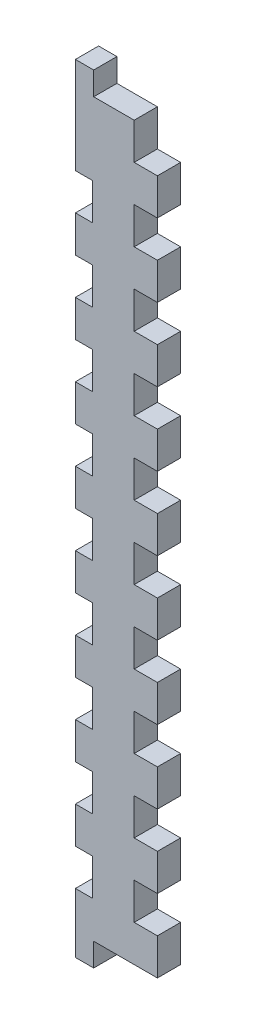
from build123d import *

# Parameters (mm, degrees)
SKETCH1_W           = 22.4282
SKETCH1_H           = 200
BOSS_EXTRUDE1_DEPTH = 6.35
SKETCH2_W           = 4.6228
SKETCH2_H           = 10
CUT_EXTRUDE2_DEPTH  = 6.35
SKETCH13_W          = 6.35
SKETCH13_H          = 10
CUT_EXTRUDE4_DEPTH  = 6.35
LPATTERN1_COUNT     = 9
LPATTERN1_PITCH     = 20
LPATTERN2_COUNT     = 10
LPATTERN2_PITCH     = 20
SKETCH14_W          = 5.0038
SKETCH14_H          = 6.35
BOSS_EXTRUDE4_DEPTH = 6.35


with BuildPart() as part:
    # Sketch1 → Boss-Extrude1 (new body)
    with BuildSketch(Plane.XY):
        Rectangle(SKETCH1_W, SKETCH1_H)
    extrude(amount=BOSS_EXTRUDE1_DEPTH)

    # Sketch2 → Cut-Extrude2 (cut)
    with BuildSketch(Plane.XY.offset(6.35)):
        with Locations((-8.9027, -85)):
            Rectangle(SKETCH2_W, SKETCH2_H)
    cut_extrude2 = extrude(amount=-CUT_EXTRUDE2_DEPTH, mode=Mode.SUBTRACT)

    # Sketch13 → Cut-Extrude4 (cut)
    with BuildSketch(Plane.XY.offset(6.35)):
        with Locations((8.0391, -85)):
            Rectangle(SKETCH13_W, SKETCH13_H)
    cut_extrude4 = extrude(amount=-CUT_EXTRUDE4_DEPTH, mode=Mode.SUBTRACT)

    # LPattern1: Cut-Extrude2 ×9
    with Locations(*[(0, i * LPATTERN1_PITCH, 0) for i in range(1, LPATTERN1_COUNT)]):
        add(cut_extrude2, mode=Mode.SUBTRACT)

    # LPattern2: Cut-Extrude4 ×10
    with Locations(*[(0, i * LPATTERN2_PITCH, 0) for i in range(1, LPATTERN2_COUNT)]):
        add(cut_extrude4, mode=Mode.SUBTRACT)

    # Sketch14 → Boss-Extrude4 (add)
    with BuildSketch(Plane.XY):
        with Locations((-8.7122, 103.175)):
            Rectangle(SKETCH14_W, SKETCH14_H)
        with Locations((-8.7122, -103.175)):
            Rectangle(SKETCH14_W, SKETCH14_H)
    extrude(amount=BOSS_EXTRUDE4_DEPTH)


solid = part.part
